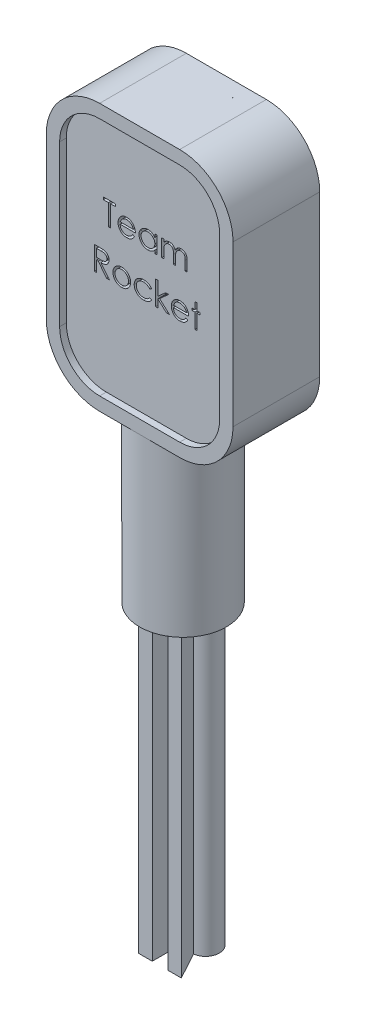
from build123d import *

# Parameters (mm, degrees)
BOSS_EXTRUDE4_DEPTH = 45
SKETCH9_R           = 6.5
BOSS_EXTRUDE5_DEPTH = 25
SKETCH10_W          = 28
SKETCH10_H          = 13
SKETCH10_R          = 0.037506011
BOSS_EXTRUDE6_DEPTH = 40
FILLET3_R           = 8
FILLET4_R           = 8
FILLET5_R           = 8
FILLET6_R           = 8
CUT_EXTRUDE1_DEPTH  = 1
CUT_EXTRUDE2_START  = -1
CUT_EXTRUDE2_DEPTH  = 1
CUT_EXTRUDE3_DEPTH  = 1.5


with BuildPart() as part:
    # Sketch7 → Boss-Extrude4 (new body)
    with BuildSketch(Plane(origin=(0, 0, 0), x_dir=(1, 0, 0), z_dir=(0, 1, 0))):
        with BuildLine():
            Line((-2.73, 4.18), (-2.73, -3.96))
            Line((-2.73, -3.96), (-0.65, -3.96))
            Line((-0.65, -3.96), (-0.65, 0.209911087))
            Line((-0.65, 0.209911087), (-0.55, 0.209911087))
            Line((-0.55, 0.209911087), (-0.544629905, 0.2))
            Line((-0.544629905, 0.2), (1.709370676, -3.96))
            Line((1.709370676, -3.96), (3.701899661, -3.96))
            Line((3.701899661, -3.96), (1.514445796, 0.077180893))
            ThreePointArc((1.514445796, 0.077180893), (3.325047346, 2.243748049), (1.27, 4.18))
            Line((1.27, 4.18), (-2.73, 4.18))
        make_face()
    extrude(amount=BOSS_EXTRUDE4_DEPTH)

    # Sketch9 → Boss-Extrude5 (add)
    with BuildSketch(Plane(origin=(0, 45, 0), x_dir=(1, 0, 0), z_dir=(0, 1, 0))):
        with Locations(Location((0, 0, 0), (0, 0, 270))):
            Circle(SKETCH9_R)
    extrude(amount=BOSS_EXTRUDE5_DEPTH)

    # Sketch10 → Boss-Extrude6 (add)
    with BuildSketch(Plane(origin=(0, 70, 0), x_dir=(1, 0, 0), z_dir=(0, 1, 0))):
        Rectangle(SKETCH10_W, SKETCH10_H)
        with Locations(Location((3.255474538, 4.236787445, 0), (0, 0, 270))):
            Circle(SKETCH10_R, mode=Mode.SUBTRACT)
    extrude(amount=BOSS_EXTRUDE6_DEPTH)

    # Fillet3
    # the kernel refuses this fillet: 8 mm, written as the material it takes off along each edge
    with BuildSketch(Plane(origin=(14, 70, -26.5), x_dir=(-1, 0, 0), z_dir=(0, 0, 1))) as fillet3_piece_1_section:
        with BuildLine():
            CenterArc((FILLET3_R, -FILLET3_R), FILLET3_R, 90, 90)
            Line((0, -FILLET3_R), (0, 0))
            Line((0, 0), (FILLET3_R, 0))
        make_face()
    fillet3_piece_1 = extrude(amount=53, mode=Mode.PRIVATE)
    fillet3_piece_1 = fillet3_piece_1 - Plane(origin=(0, 71.811761392, 0), x_dir=(0, 0, 1), z_dir=(0, -1, 0)) * Cylinder(6.5, 138, mode=Mode.PRIVATE)
    add(fillet3_piece_1, mode=Mode.SUBTRACT)

    # Fillet4
    # the kernel refuses this fillet: 8 mm, written as the material it takes off along each edge
    with BuildSketch(Plane(origin=(-14, 70, 26.5), x_dir=(1, 0, 0), z_dir=(0, 0, -1))) as fillet4_piece_1_section:
        with BuildLine():
            CenterArc((FILLET4_R, -FILLET4_R), FILLET4_R, 90, 90)
            Line((0, -FILLET4_R), (0, 0))
            Line((0, 0), (FILLET4_R, 0))
        make_face()
    fillet4_piece_1 = extrude(amount=53, mode=Mode.PRIVATE)
    fillet4_piece_1 = fillet4_piece_1 - Plane(origin=(0, 71.811761392, 0), x_dir=(0, 0, 1), z_dir=(0, -1, 0)) * Cylinder(6.5, 138, mode=Mode.PRIVATE)
    add(fillet4_piece_1, mode=Mode.SUBTRACT)

    # Fillet5
    fillet5_edges = [part.edges().sort_by_distance(p)[0] for p in [
        (14, 110, 0),
    ]]
    fillet(fillet5_edges, radius=FILLET5_R)

    # Fillet6
    fillet6_edges = [part.edges().sort_by_distance(p)[0] for p in [
        (-14, 110, 0),
    ]]
    fillet(fillet6_edges, radius=FILLET6_R)

    # Sketch11 → Cut-Extrude1 (cut)
    with BuildSketch(Plane(origin=(0, 0, -6.5), x_dir=(-1, 0, 0), z_dir=(0, 0, -1))):
        with BuildLine():
            Line((12, 78), (12, 102))
            ThreePointArc((12, 102), (10.242640687, 106.242640687), (6, 108))
            Line((6, 108), (-6, 108))
            ThreePointArc((-6, 108), (-10.242640687, 106.242640687), (-12, 102))
            Line((-12, 102), (-12, 78))
            ThreePointArc((-12, 78), (-10.242640687, 73.757359313), (-6, 72))
            Line((-6, 72), (0, 72))
            Line((0, 72), (6, 72))
            ThreePointArc((6, 72), (10.242640687, 73.757359313), (12, 78))
        make_face()
    extrude(amount=-CUT_EXTRUDE1_DEPTH, mode=Mode.SUBTRACT)

    # Sketch12 → Cut-Extrude2 (cut)
    with BuildSketch(Plane.XY.offset(6.5).offset(CUT_EXTRUDE2_START)):
        with BuildLine():
            Line((6, 108), (-6, 108))
            ThreePointArc((-6, 108), (-10.242640687, 106.242640687), (-12, 102))
            Line((-12, 102), (-12, 78))
            ThreePointArc((-12, 78), (-10.242640687, 73.757359313), (-6, 72))
            Line((-6, 72), (0, 72))
            Line((0, 72), (6, 72))
            ThreePointArc((6, 72), (10.242640687, 73.757359313), (12, 78))
            Line((12, 78), (12, 102))
            ThreePointArc((12, 102), (10.242640687, 106.242640687), (6, 108))
        make_face()
    extrude(amount=CUT_EXTRUDE2_DEPTH, mode=Mode.SUBTRACT)

    # Sketch13 → Cut-Extrude3 (cut)
    # profile 1 of 10: a face of its own
    with BuildSketch(Plane.XY.offset(5.5)):
        Polygon((-6.439102564, 96.768314643), (-6.439102564, 97.127289002), (-4.599358974, 97.127289002), (-4.599358974, 96.768314643), (-5.362179487, 96.768314643), (-5.362179487, 93.627289002), (-5.676282051, 93.627289002), (-5.676282051, 96.768314643), align=None)
    # profile 2 of 10: a face of its own
    with BuildSketch(Plane.XY.offset(5.5)):
        with BuildLine():
            Line((-2.051482372, 94.434981309), (-1.772435897, 94.288446854))
            add(Edge.make_bspline(
                [(-1.772435897, 94.288446854), (-1.794672493, 94.249003523), (-1.837936101, 94.17226242), (-1.912336849, 94.06683056), (-1.990328922, 93.971982844), (-2.07543289, 93.89025319), (-2.165102569, 93.819001805), (-2.259835223, 93.75666398), (-2.360124041, 93.70354546), (-2.465973766, 93.658792932), (-2.578273317, 93.624383438), (-2.697294833, 93.600079217), (-2.823266329, 93.585055948), (-2.909612509, 93.583310807), (-2.953826122, 93.582417207)],
                knots=[0, 0, 0, 0, 1.120438281, 2.179929193, 3.190490725, 4.156257408, 5.095198341, 6.022838206, 6.959905092, 7.901321166, 8.864066838, 9.862729781, 10.905609505, 12, 12, 12, 12], degree=3))
            add(Edge.make_bspline(
                [(-2.953826122, 93.582417207), (-3.002968099, 93.583564382), (-3.098829861, 93.585802189), (-3.238369608, 93.605094653), (-3.369749026, 93.636567012), (-3.49296073, 93.680532553), (-3.607702982, 93.737959878), (-3.714203837, 93.807919359), (-3.813023363, 93.890051614), (-3.901047572, 93.985068058), (-3.980291455, 94.086750015), (-4.050217275, 94.192705899), (-4.108674706, 94.302669124), (-4.156227316, 94.415939648), (-4.194632181, 94.531803541), (-4.221398885, 94.651315009), (-4.236828633, 94.774150593), (-4.239193078, 94.857247929), (-4.240384615, 94.899123938)],
                knots=[0, 0, 0, 0, 1.145258523, 2.234067595, 3.276747158, 4.290159414, 5.277019952, 6.260822364, 7.254936242, 8.264827045, 9.274100331, 10.257902744, 11.220704747, 12.172965371, 13.118907548, 14.062713208, 15.023725156, 16, 16, 16, 16], degree=3))
            add(Edge.make_bspline(
                [(-4.240384615, 94.899123938), (-4.239325474, 94.938418768), (-4.237226396, 95.016295933), (-4.223995608, 95.131561477), (-4.200547315, 95.24358993), (-4.168370991, 95.352474378), (-4.126819745, 95.458032512), (-4.075987526, 95.560328575), (-4.015795148, 95.659253715), (-3.969322474, 95.721656849), (-3.945913462, 95.753090284)],
                knots=[0, 0, 0, 0, 1.024358464, 2.0301432, 3.019427413, 4.004406732, 4.986367066, 5.972626655, 6.978780325, 8, 8, 8, 8], degree=3))
            add(Edge.make_bspline(
                [(-3.945913462, 95.753090284), (-3.914205779, 95.790959154), (-3.851794832, 95.865497304), (-3.746238477, 95.96343563), (-3.63193828, 96.045479405), (-3.510326654, 96.113486541), (-3.37999018, 96.165160188), (-3.242680889, 96.203667771), (-3.096835303, 96.225245782), (-2.997130082, 96.228293615), (-2.946113782, 96.229853104)],
                knots=[0, 0, 0, 0, 1.030682036, 2.02871468, 2.997146059, 3.962720338, 4.930598197, 5.918074684, 6.934738563, 8, 8, 8, 8], degree=3))
            add(Edge.make_bspline(
                [(-2.946113782, 96.229853104), (-2.893666177, 96.228499055), (-2.790775931, 96.22584272), (-2.64074381, 96.201216387), (-2.498783093, 96.162163832), (-2.364950589, 96.107010042), (-2.239232728, 96.03585049), (-2.122446679, 95.947708648), (-2.012595166, 95.845290561), (-1.948686587, 95.766527352), (-1.916165865, 95.726447656)],
                knots=[0, 0, 0, 0, 1.056321875, 2.072262726, 3.055038591, 4.01806755, 4.982017516, 5.957941055, 6.960871419, 8, 8, 8, 8], degree=3))
            add(Edge.make_bspline(
                [(-1.916165865, 95.726447656), (-1.894038927, 95.696244074), (-1.849932334, 95.636037955), (-1.794685234, 95.537866798), (-1.746727839, 95.435156204), (-1.708394878, 95.326245907), (-1.677355377, 95.212426327), (-1.654898558, 95.092883782), (-1.641728939, 94.967653871), (-1.639140242, 94.882327315), (-1.637820513, 94.838827463)],
                knots=[0, 0, 0, 0, 0.94817472, 1.890038105, 2.849395472, 3.817997239, 4.812318967, 5.836947057, 6.897266129, 8, 8, 8, 8], degree=3))
            Line((-1.637820513, 94.838827463), (-3.926282051, 94.838827463))
            add(Edge.make_bspline(
                [(-3.926282051, 94.838827463), (-3.924742445, 94.805126999), (-3.921714871, 94.738856395), (-3.907599728, 94.641885612), (-3.885350954, 94.54951227), (-3.854081891, 94.462429228), (-3.816215046, 94.3794991), (-3.769829329, 94.301337064), (-3.714489775, 94.228299133), (-3.652764076, 94.159731996), (-3.584056981, 94.098671235), (-3.511774233, 94.044019458), (-3.434880668, 93.998213862), (-3.353982585, 93.961033972), (-3.2692108, 93.931927656), (-3.180538605, 93.912059835), (-3.088140488, 93.898752728), (-3.025154754, 93.897273063), (-2.993088942, 93.896519771)],
                knots=[0, 0, 0, 0, 1.094153842, 2.151609401, 3.174256925, 4.172055639, 5.149267565, 6.128595816, 7.11444997, 8.118368179, 9.117203808, 10.09244225, 11.054858984, 12.015122123, 12.976791628, 13.957293641, 14.960065497, 16, 16, 16, 16], degree=3))
            add(Edge.make_bspline(
                [(-2.993088942, 93.896519771), (-2.961737795, 93.897127828), (-2.899531104, 93.898334329), (-2.806890246, 93.91006624), (-2.715750719, 93.929036515), (-2.626489736, 93.954926505), (-2.54091889, 93.986503357), (-2.46167334, 94.024606215), (-2.388793124, 94.066755962), (-2.320676158, 94.114965637), (-2.254605164, 94.173973824), (-2.189062678, 94.247609545), (-2.118786024, 94.334697073), (-2.074796432, 94.400242739), (-2.051482372, 94.434981309)],
                knots=[0, 0, 0, 0, 0.99110716, 1.966546729, 2.947904876, 3.932708344, 4.903319531, 5.828989031, 6.710028674, 7.56322171, 8.463672341, 9.504779593, 10.677557249, 12, 12, 12, 12], degree=3))
        make_face()
        with BuildLine():
            add(Edge.make_bspline(
                [(-1.951923077, 95.152930027), (-1.963419701, 95.194592901), (-1.985547003, 95.274780522), (-2.031783367, 95.385821412), (-2.083854908, 95.484509313), (-2.145476639, 95.570088946), (-2.215295365, 95.646092459), (-2.295940548, 95.712511044), (-2.386376441, 95.771928495), (-2.486135582, 95.822080995), (-2.591777367, 95.864770854), (-2.702383559, 95.893395969), (-2.815241347, 95.913005512), (-2.891575633, 95.91483162), (-2.929987981, 95.91575054)],
                knots=[0, 0, 0, 0, 1.154881502, 2.222775134, 3.210006277, 4.132804581, 5.035138423, 5.962687519, 6.919655026, 7.923214229, 8.944639381, 9.960483929, 10.97369054, 12, 12, 12, 12], degree=3))
            add(Edge.make_bspline(
                [(-2.929987981, 95.91575054), (-2.961337419, 95.915138869), (-3.023308668, 95.913929723), (-3.114609737, 95.902459593), (-3.202289435, 95.883499748), (-3.286994723, 95.857534792), (-3.367615591, 95.822926189), (-3.44581036, 95.782342963), (-3.519590756, 95.732801379), (-3.565732051, 95.695042524), (-3.589042468, 95.675966886)],
                knots=[0, 0, 0, 0, 1.04873581, 2.073130211, 3.073294108, 4.04793562, 5.032784715, 6.005352987, 6.992311501, 8, 8, 8, 8], degree=3))
            add(Edge.make_bspline(
                [(-3.589042468, 95.675966886), (-3.60573575, 95.660872571), (-3.639518884, 95.630325355), (-3.684659406, 95.577696148), (-3.727879878, 95.520944586), (-3.767213531, 95.457899461), (-3.803291118, 95.389278682), (-3.837051095, 95.315661047), (-3.867437507, 95.236487917), (-3.884533617, 95.181315478), (-3.893329327, 95.152930027)],
                knots=[0, 0, 0, 0, 0.879870761, 1.780643979, 2.707998968, 3.669668524, 4.684282772, 5.740141944, 6.837334558, 8, 8, 8, 8], degree=3))
            Line((-3.893329327, 95.152930027), (-1.951923077, 95.152930027))
        make_face(mode=Mode.SUBTRACT)
    # profile 3 of 10: a face of its own
    with BuildSketch(Plane.XY.offset(5.5)):
        with BuildLine():
            Line((1.592948718, 96.184981309), (1.592948718, 93.627289002))
            Line((1.592948718, 93.627289002), (1.278846154, 93.627289002))
            Line((1.278846154, 93.627289002), (1.278846154, 94.069696854))
            add(Edge.make_bspline(
                [(1.278846154, 94.069696854), (1.243427363, 94.02965726), (1.174307148, 93.951519489), (1.05886603, 93.849437317), (0.936497852, 93.765058995), (0.807796531, 93.696909079), (0.672878288, 93.645717023), (0.5320422, 93.609330864), (0.385230819, 93.585937029), (0.284978465, 93.583601007), (0.234174679, 93.582417207)],
                knots=[0, 0, 0, 0, 1.074387032, 2.096679803, 3.090159297, 4.057316773, 5.018401886, 5.985159533, 6.978961417, 8, 8, 8, 8], degree=3))
            add(Edge.make_bspline(
                [(0.234174679, 93.582417207), (0.189006726, 93.583643579), (0.099933521, 93.58606204), (-0.031095556, 93.604824343), (-0.157187806, 93.634954965), (-0.278462378, 93.676855854), (-0.394134524, 93.732436676), (-0.505194621, 93.798977924), (-0.611067313, 93.878218754), (-0.710138852, 93.968806782), (-0.801370852, 94.06720177), (-0.881432125, 94.172147316), (-0.948185204, 94.28318962), (-1.004005285, 94.398922774), (-1.04700163, 94.520237694), (-1.076975264, 94.646714862), (-1.095715711, 94.778204735), (-1.098133171, 94.867744258), (-1.099358974, 94.913146373)],
                knots=[0, 0, 0, 0, 1.033919861, 2.038935746, 3.024066025, 3.998881131, 4.97069526, 5.957263378, 6.95902576, 7.993208707, 9.027059324, 10.027763471, 11.009749337, 11.988697705, 12.965288445, 13.950418724, 14.960734635, 16, 16, 16, 16], degree=3))
            add(Edge.make_bspline(
                [(-1.099358974, 94.913146373), (-1.098106003, 94.957610077), (-1.095628946, 95.04551242), (-1.077175726, 95.174791118), (-1.046144718, 95.299309379), (-1.00259687, 95.418666322), (-0.946754915, 95.533006372), (-0.878826828, 95.642410397), (-0.798807703, 95.747179795), (-0.706555296, 95.844851022), (-0.606620526, 95.935071636), (-0.499711795, 96.013480681), (-0.388488514, 96.08119753), (-0.271225503, 96.134851007), (-0.149658399, 96.178260111), (-0.022704953, 96.208293079), (0.109106626, 96.2259904), (0.198597118, 96.228553165), (0.243990385, 96.229853104)],
                knots=[0, 0, 0, 0, 1.020392517, 2.01726096, 2.990465484, 3.961182959, 4.928053699, 5.906110375, 6.912531644, 7.948652711, 8.985773172, 9.998621852, 10.987621588, 11.969261332, 12.953316658, 13.946091881, 14.958173133, 16, 16, 16, 16], degree=3))
            add(Edge.make_bspline(
                [(0.243990385, 96.229853104), (0.296190244, 96.228415353), (0.398551704, 96.22559599), (0.548279713, 96.202133262), (0.689924191, 96.162494795), (0.824578543, 96.108577297), (0.951759229, 96.036928568), (1.070262213, 95.946548607), (1.181327697, 95.83800742), (1.245707988, 95.754636976), (1.278846154, 95.711724098)],
                knots=[0, 0, 0, 0, 1.038897134, 2.037228247, 3.008116434, 3.962042015, 4.918381754, 5.904844433, 6.921570401, 8, 8, 8, 8], degree=3))
            Line((1.278846154, 95.711724098), (1.278846154, 96.184981309))
            Line((1.278846154, 96.184981309), (1.592948718, 96.184981309))
        make_face()
        with BuildLine():
            add(Edge.make_bspline(
                [(0.248197115, 95.91575054), (0.202282778, 95.914116902), (0.111655178, 95.910892361), (-0.021388825, 95.885718866), (-0.148702239, 95.843834272), (-0.269648313, 95.786552371), (-0.382316529, 95.714523634), (-0.4830102, 95.627402251), (-0.572552902, 95.527565237), (-0.647861166, 95.415463126), (-0.709251663, 95.295285035), (-0.752418695, 95.169660597), (-0.780887942, 95.040855619), (-0.783796463, 94.953492934), (-0.78525641, 94.909640765)],
                knots=[0, 0, 0, 0, 1.031046209, 2.035121221, 3.029706178, 4.034933723, 5.034054252, 6.02443088, 7.017295772, 8.038157696, 9.050218397, 10.03989886, 11.016116709, 12, 12, 12, 12], degree=3))
            add(Edge.make_bspline(
                [(-0.78525641, 94.909640765), (-0.783391517, 94.866050657), (-0.77966904, 94.779041301), (-0.752918346, 94.650060725), (-0.708038472, 94.524406683), (-0.64679641, 94.403145689), (-0.570109785, 94.290561589), (-0.481221132, 94.188821466), (-0.379270851, 94.101331878), (-0.266343344, 94.028094304), (-0.145735373, 93.968931783), (-0.018901442, 93.927766144), (0.111774196, 93.901188363), (0.20062653, 93.898083886), (0.245392628, 93.896519771)],
                knots=[0, 0, 0, 0, 0.979072187, 1.954306742, 2.945804271, 3.96968567, 4.997920485, 5.998718438, 6.996577872, 8.005894225, 9.015743152, 10.005417472, 10.995077863, 12, 12, 12, 12], degree=3))
            add(Edge.make_bspline(
                [(0.245392628, 93.896519771), (0.290839131, 93.898179735), (0.381227717, 93.901481238), (0.514666425, 93.926762504), (0.644161388, 93.968531302), (0.767948617, 94.026430429), (0.883264748, 94.098187785), (0.986762625, 94.182194876), (1.074278594, 94.27989806), (1.148471203, 94.387274513), (1.20664662, 94.504986509), (1.249022679, 94.6303207), (1.274076585, 94.763281448), (1.277234315, 94.854145375), (1.278846154, 94.900526181)],
                knots=[0, 0, 0, 0, 1.01762866, 2.023962475, 3.030623092, 4.058876274, 5.077231937, 6.066672613, 7.034107872, 8.005628644, 8.981990164, 9.965428785, 10.961468474, 12, 12, 12, 12], degree=3))
            add(Edge.make_bspline(
                [(1.278846154, 94.900526181), (1.277886497, 94.935864012), (1.27599759, 95.005420045), (1.261567021, 95.107547563), (1.238612094, 95.205281289), (1.206265924, 95.298723978), (1.16377464, 95.387358993), (1.112526874, 95.471822753), (1.051621424, 95.551675965), (0.982038728, 95.625819036), (0.905873525, 95.693445498), (0.825278985, 95.753809739), (0.739300238, 95.803398511), (0.649383201, 95.844439783), (0.555371866, 95.877098933), (0.456501247, 95.898886627), (0.35382226, 95.913846948), (0.283776204, 95.915109328), (0.248197115, 95.91575054)],
                knots=[0, 0, 0, 0, 1.050140795, 2.067009409, 3.05949893, 4.030605086, 5.00011959, 5.97591094, 6.962425594, 7.979863591, 8.993523472, 9.986985069, 10.967611495, 11.937549037, 12.921786183, 13.919465291, 14.943216303, 16, 16, 16, 16], degree=3))
        make_face(mode=Mode.SUBTRACT)
    # profile 4 of 10: a face of its own
    with BuildSketch(Plane.XY.offset(5.5)):
        with BuildLine():
            Line((2.310897436, 96.184981309), (2.625, 96.184981309))
            Line((2.625, 96.184981309), (2.625, 95.740470091))
            add(Edge.make_bspline(
                [(2.625, 95.740470091), (2.65328395, 95.779357693), (2.70747871, 95.853870066), (2.796344362, 95.95206035), (2.885120474, 96.035388505), (2.949053856, 96.079131377), (2.979767628, 96.100145572)],
                knots=[0, 0, 0, 0, 1.134379233, 2.173579362, 3.122582517, 4, 4, 4, 4], degree=3))
            add(Edge.make_bspline(
                [(2.979767628, 96.100145572), (3.02163229, 96.120150937), (3.10463019, 96.159812151), (3.236049415, 96.20004571), (3.370524085, 96.224770811), (3.461332298, 96.228152185), (3.507011218, 96.229853104)],
                knots=[0, 0, 0, 0, 1.014936303, 2.012140481, 3.000054389, 4, 4, 4, 4], degree=3))
            add(Edge.make_bspline(
                [(3.507011218, 96.229853104), (3.537904215, 96.228807813), (3.599039794, 96.226739239), (3.689623884, 96.213279204), (3.777482495, 96.190013031), (3.862096525, 96.157605707), (3.941817204, 96.11835902), (4.014906402, 96.072309312), (4.08053061, 96.020612237), (4.138656661, 95.960933304), (4.190925687, 95.891596705), (4.239004533, 95.810732456), (4.283429746, 95.716524795), (4.308051055, 95.648158254), (4.321013622, 95.612164803)],
                knots=[0, 0, 0, 0, 1.009824226, 1.998387844, 2.986035974, 3.974953746, 4.955485308, 5.885931332, 6.793869504, 7.679848016, 8.601185859, 9.625726857, 10.749998409, 12, 12, 12, 12], degree=3))
            add(Edge.make_bspline(
                [(4.321013622, 95.612164803), (4.334724873, 95.636889222), (4.36170669, 95.685543407), (4.407012327, 95.754401669), (4.454480124, 95.818808461), (4.504514617, 95.878814886), (4.556939204, 95.934124616), (4.612000604, 95.984920518), (4.669385385, 96.031420731), (4.749177625, 96.085743891), (4.852990233, 96.143445072), (4.983878347, 96.193473516), (5.120028519, 96.224389645), (5.212446217, 96.228019917), (5.259114583, 96.229853104)],
                knots=[0, 0, 0, 0, 0.86119277, 1.694706429, 2.50939023, 3.298075842, 4.073795165, 4.829715201, 5.57930267, 6.321991688, 7.768977793, 9.186738141, 10.579381044, 12, 12, 12, 12], degree=3))
            add(Edge.make_bspline(
                [(5.259114583, 96.229853104), (5.301996046, 96.228235883), (5.385919232, 96.225070825), (5.508096498, 96.200217352), (5.622038303, 96.157539705), (5.72751538, 96.099306068), (5.822675193, 96.026126885), (5.905391502, 95.939058047), (5.975161866, 95.838715424), (6.020740505, 95.744323436), (6.051655769, 95.660988103), (6.070717004, 95.589981811), (6.087556699, 95.511830258), (6.101537944, 95.426439997), (6.111756496, 95.333509389), (6.119327212, 95.233190513), (6.124451285, 95.125405401), (6.124813358, 95.051039901), (6.125, 95.012705668)],
                knots=[0, 0, 0, 0, 1.209669288, 2.367440248, 3.500751976, 4.631527125, 5.755587489, 6.87532382, 8.007944318, 9.190864318, 9.82315674, 10.514484317, 11.263564316, 12.079023757, 12.955305781, 13.901327259, 14.918167583, 16, 16, 16, 16], degree=3))
            Line((6.125, 95.012705668), (6.125, 93.627289002))
            Line((6.125, 93.627289002), (5.810897436, 93.627289002))
            Line((5.810897436, 93.627289002), (5.810897436, 95.014107912))
            add(Edge.make_bspline(
                [(5.810897436, 95.014107912), (5.810819553, 95.046828486), (5.810669874, 95.109712453), (5.807976242, 95.199964904), (5.802900928, 95.282233261), (5.796966289, 95.356405349), (5.78872248, 95.422654138), (5.778076548, 95.480846556), (5.766798868, 95.531440368), (5.748062877, 95.587526415), (5.718114986, 95.649396626), (5.672497506, 95.716120202), (5.615027399, 95.774201002), (5.548667243, 95.824619319), (5.473118798, 95.86561296), (5.389854075, 95.894888969), (5.299390023, 95.913011848), (5.236767235, 95.914817863), (5.204427083, 95.91575054)],
                knots=[0, 0, 0, 0, 1.253487763, 2.409012846, 3.458416907, 4.410876679, 5.259312806, 6.014470957, 6.676830364, 7.243083969, 8.276244668, 9.299465089, 10.325150304, 11.392391894, 12.482080715, 13.603491619, 14.762376348, 16, 16, 16, 16], degree=3))
            add(Edge.make_bspline(
                [(5.204427083, 95.91575054), (5.164757129, 95.914334383), (5.086354218, 95.911535517), (4.971908732, 95.882961644), (4.861937715, 95.839881394), (4.759722582, 95.777448937), (4.665694791, 95.702640573), (4.584795214, 95.613690977), (4.517963028, 95.51306105), (4.472709052, 95.419914348), (4.444119751, 95.336244904), (4.425242835, 95.263147532), (4.410559444, 95.180065964), (4.396788914, 95.087558473), (4.387801186, 94.984988293), (4.379632814, 94.872829892), (4.375811951, 94.750745932), (4.375277492, 94.666119244), (4.375, 94.622180829)],
                knots=[0, 0, 0, 0, 1.090531906, 2.155305635, 3.229839962, 4.33261226, 5.44038871, 6.529323825, 7.629011124, 8.757537029, 9.370236727, 10.061839251, 10.834451254, 11.692844982, 12.636905849, 13.66920014, 14.789842145, 16, 16, 16, 16], degree=3))
            Line((4.375, 94.622180829), (4.375, 93.627289002))
            Line((4.375, 93.627289002), (4.060897436, 93.627289002))
            Line((4.060897436, 93.627289002), (4.060897436, 94.927869931))
            add(Edge.make_bspline(
                [(4.060897436, 94.927869931), (4.060818005, 94.96456325), (4.060665188, 95.035157507), (4.05798887, 95.136391182), (4.052902249, 95.228472263), (4.0470217, 95.311293726), (4.038561522, 95.384705055), (4.02895176, 95.449099813), (4.017603149, 95.504316564), (3.998813265, 95.564879949), (3.970098796, 95.631600872), (3.923910534, 95.702741893), (3.866302954, 95.765009991), (3.798732078, 95.818168739), (3.722726396, 95.86211022), (3.638742995, 95.893769972), (3.547538082, 95.912194262), (3.484660376, 95.914542759), (3.452323718, 95.91575054)],
                knots=[0, 0, 0, 0, 1.320475261, 2.540461679, 3.643808994, 4.639130445, 5.527981419, 6.302341397, 6.981980563, 7.553956391, 8.582137848, 9.585246428, 10.591171744, 11.620968678, 12.668337649, 13.738356861, 14.836885341, 16, 16, 16, 16], degree=3))
            add(Edge.make_bspline(
                [(3.452323718, 95.91575054), (3.414307506, 95.91422008), (3.338542547, 95.911169928), (3.227240577, 95.883715654), (3.119754894, 95.840711579), (3.017800195, 95.78105176), (2.924126047, 95.707152681), (2.842117779, 95.620237786), (2.773175254, 95.521388752), (2.727443439, 95.429224236), (2.697944965, 95.347650961), (2.67834963, 95.278300013), (2.661510004, 95.201299765), (2.648995983, 95.116412654), (2.636915567, 95.02419156), (2.631085258, 94.92417707), (2.625413696, 94.816454982), (2.625141281, 94.742082437), (2.625, 94.703510957)],
                knots=[0, 0, 0, 0, 1.098833095, 2.189935336, 3.297829714, 4.440610912, 5.596351641, 6.740013378, 7.886572111, 9.072425424, 9.705826452, 10.395263256, 11.156850408, 11.985370555, 12.878090359, 13.847760091, 14.883794034, 16, 16, 16, 16], degree=3))
            Line((2.625, 94.703510957), (2.625, 93.627289002))
            Line((2.625, 93.627289002), (2.310897436, 93.627289002))
            Line((2.310897436, 93.627289002), (2.310897436, 96.184981309))
        make_face()
    # profile 5 of 10: a face of its own
    with BuildSketch(Plane.XY.offset(5.5)):
        with BuildLine():
            Line((-7.78525641, 90.293955668), (-7.084835737, 90.293955668))
            add(Edge.make_bspline(
                [(-7.084835737, 90.293955668), (-7.038094609, 90.293800082), (-6.948346464, 90.29350134), (-6.819773194, 90.291835577), (-6.702946097, 90.287061221), (-6.597926258, 90.282952638), (-6.504715603, 90.275460697), (-6.423028312, 90.26830005), (-6.353240614, 90.258926389), (-6.310994763, 90.250220966), (-6.291866987, 90.246279386)],
                knots=[0, 0, 0, 0, 1.410062039, 2.707475311, 3.878576406, 4.937260626, 5.877586885, 6.699081471, 7.410979367, 8, 8, 8, 8], degree=3))
            add(Edge.make_bspline(
                [(-6.291866987, 90.246279386), (-6.266260363, 90.239952621), (-6.215593374, 90.227434057), (-6.142643308, 90.200974456), (-6.073128984, 90.170354832), (-6.007339159, 90.134391112), (-5.945603368, 90.092816332), (-5.887285057, 90.046348209), (-5.832119594, 89.995241004), (-5.782337964, 89.938206162), (-5.735398912, 89.878369652), (-5.695810286, 89.813665896), (-5.661683806, 89.746004368), (-5.634513289, 89.67469695), (-5.612635315, 89.600435178), (-5.597209076, 89.522546382), (-5.587957888, 89.441385407), (-5.587016033, 89.386027498), (-5.586538462, 89.357958072)],
                knots=[0, 0, 0, 0, 1.027469482, 2.033020251, 3.019912614, 3.986113645, 4.951240523, 5.91722682, 6.890402269, 7.87763091, 8.8651537, 9.85103654, 10.82876324, 11.815024772, 12.821070561, 13.842952187, 14.906261191, 16, 16, 16, 16], degree=3))
            add(Edge.make_bspline(
                [(-5.586538462, 89.357958072), (-5.58800746, 89.311322968), (-5.590873855, 89.2203258), (-5.617598959, 89.088264918), (-5.661375479, 88.965075604), (-5.721698768, 88.850912966), (-5.798518244, 88.74800232), (-5.890843035, 88.657611865), (-5.998724646, 88.581971952), (-6.099153962, 88.529519148), (-6.187868162, 88.495926239), (-6.260901475, 88.47228988), (-6.340568452, 88.454027915), (-6.426105787, 88.437667783), (-6.517869442, 88.425316089), (-6.615639482, 88.416269494), (-6.719485633, 88.410615446), (-6.790824703, 88.409773441), (-6.827524038, 88.409340284)],
                knots=[0, 0, 0, 0, 1.260483769, 2.459530307, 3.627416485, 4.787058657, 5.939039949, 7.08810263, 8.267026773, 9.491475466, 10.141966685, 10.831826277, 11.566392101, 12.351337768, 13.187381173, 14.07005841, 15.007169909, 16, 16, 16, 16], degree=3))
            Line((-6.827524038, 88.409340284), (-5.541666667, 86.793955668))
            Line((-5.541666667, 86.793955668), (-5.930088141, 86.793955668))
            Line((-5.930088141, 86.793955668), (-7.215945513, 88.409340284))
            Line((-7.215945513, 88.409340284), (-7.471153846, 88.409340284))
            Line((-7.471153846, 88.409340284), (-7.471153846, 86.793955668))
            Line((-7.471153846, 86.793955668), (-7.78525641, 86.793955668))
            Line((-7.78525641, 86.793955668), (-7.78525641, 90.293955668))
        make_face()
        with BuildLine():
            Line((-7.471153846, 89.934981309), (-7.471153846, 88.768314643))
            Line((-7.471153846, 88.768314643), (-6.830328526, 88.76340679))
            add(Edge.make_bspline(
                [(-6.830328526, 88.76340679), (-6.800408487, 88.763393553), (-6.74241493, 88.763367897), (-6.658514265, 88.767361673), (-6.580394153, 88.771904992), (-6.508353401, 88.778854337), (-6.442359826, 88.787810409), (-6.382446412, 88.799013393), (-6.32851536, 88.812065456), (-6.265616822, 88.832267082), (-6.195380291, 88.8642731), (-6.119048831, 88.910838598), (-6.054046493, 88.969407718), (-5.999128631, 89.036381174), (-5.954999199, 89.110017423), (-5.923887145, 89.189433792), (-5.904144703, 89.27262539), (-5.901816157, 89.329803498), (-5.900641026, 89.358659194)],
                knots=[0, 0, 0, 0, 1.146690395, 2.22261258, 3.21895312, 4.145990853, 4.996080663, 5.770904154, 6.481378293, 7.121626537, 8.300444488, 9.431385265, 10.535395872, 11.636531494, 12.74115979, 13.810798291, 14.895190096, 16, 16, 16, 16], degree=3))
            add(Edge.make_bspline(
                [(-5.900641026, 89.358659194), (-5.901843147, 89.386805768), (-5.904225312, 89.442582006), (-5.923674081, 89.524237917), (-5.956563462, 89.601304867), (-6.0008857, 89.673469352), (-6.054884855, 89.738975088), (-6.118202668, 89.795022241), (-6.189107863, 89.841271705), (-6.255379061, 89.870826086), (-6.314613274, 89.888945939), (-6.366042934, 89.901697103), (-6.424154411, 89.911941572), (-6.48922987, 89.920149633), (-6.560991501, 89.927204577), (-6.639802152, 89.931956356), (-6.725138932, 89.93477022), (-6.784285863, 89.934909309), (-6.814903846, 89.934981309)],
                knots=[0, 0, 0, 0, 1.101028733, 2.181837193, 3.264309656, 4.369019818, 5.486613113, 6.575447106, 7.666700264, 8.788928104, 9.402425223, 10.0903467, 10.862060571, 11.710948788, 12.657782767, 13.684531032, 14.801375019, 16, 16, 16, 16], degree=3))
            Line((-6.814903846, 89.934981309), (-7.471153846, 89.934981309))
        make_face(mode=Mode.SUBTRACT)
    # profile 6 of 10: a face of its own
    with BuildSketch(Plane.XY.offset(5.5)):
        with BuildLine():
            add(Edge.make_bspline(
                [(-3.678084936, 89.396519771), (-3.630093663, 89.39549788), (-3.535994505, 89.393494201), (-3.39818662, 89.372079235), (-3.266641484, 89.339331871), (-3.140855292, 89.294060309), (-3.022438996, 89.233378358), (-2.909667752, 89.160969067), (-2.802850743, 89.075186474), (-2.738827714, 89.008828405), (-2.706330128, 88.975145572)],
                knots=[0, 0, 0, 0, 1.054011418, 2.066658804, 3.057071809, 4.030435133, 4.997543892, 5.974964718, 6.972108034, 8, 8, 8, 8], degree=3))
            add(Edge.make_bspline(
                [(-2.706330128, 88.975145572), (-2.678348174, 88.942931586), (-2.622925794, 88.879127044), (-2.551860075, 88.775671431), (-2.490638515, 88.668531331), (-2.441575554, 88.556284004), (-2.40289053, 88.439909333), (-2.375424834, 88.319007322), (-2.359087899, 88.193844974), (-2.356884932, 88.108841136), (-2.355769231, 88.065790604)],
                knots=[0, 0, 0, 0, 1.025258237, 2.030674902, 3.01204498, 3.988269485, 4.97094183, 5.956517959, 6.965070386, 8, 8, 8, 8], degree=3))
            add(Edge.make_bspline(
                [(-2.355769231, 88.065790604), (-2.356750568, 88.022490547), (-2.358689736, 87.936927613), (-2.377033353, 87.810908247), (-2.405564439, 87.688713425), (-2.446396277, 87.570854731), (-2.498754386, 87.456971904), (-2.562645074, 87.347562354), (-2.638516691, 87.242410221), (-2.724520688, 87.142408383), (-2.819572564, 87.050242168), (-2.922688712, 86.969913898), (-3.031842746, 86.901092374), (-3.148486099, 86.845655958), (-3.271553586, 86.801946258), (-3.401310654, 86.771246242), (-3.537555724, 86.752684558), (-3.630582946, 86.750300985), (-3.678084936, 86.749083873)],
                knots=[0, 0, 0, 0, 0.998656419, 1.973391657, 2.932242238, 3.890759089, 4.846373663, 5.82037756, 6.809684879, 7.83454468, 8.860553229, 9.859544525, 10.845671541, 11.83227036, 12.833544569, 13.85385346, 14.904124723, 16, 16, 16, 16], degree=3))
            add(Edge.make_bspline(
                [(-3.678084936, 86.749083873), (-3.725819655, 86.75030507), (-3.819310515, 86.752696844), (-3.956036497, 86.771174127), (-4.086026116, 86.801932109), (-4.209254715, 86.845799602), (-4.326399561, 86.901094146), (-4.436186058, 86.969705836), (-4.539385974, 87.050265991), (-4.634457958, 87.142401928), (-4.720456564, 87.242411884), (-4.796329572, 87.347561923), (-4.860219898, 87.456972016), (-4.912578102, 87.570854701), (-4.953409915, 87.688713433), (-4.981941008, 87.810908245), (-5.000284622, 87.936927614), (-5.002223791, 88.022490547), (-5.003205128, 88.065790604)],
                knots=[0, 0, 0, 0, 1.099876186, 2.154163076, 3.173186993, 4.173200201, 5.163417411, 6.152872554, 7.150605724, 8.17532212, 9.198891216, 10.186952605, 11.159729845, 12.11414092, 13.071450619, 14.029093627, 15.002601286, 16, 16, 16, 16], degree=3))
            add(Edge.make_bspline(
                [(-5.003205128, 88.065790604), (-5.002081818, 88.10860715), (-4.999857856, 88.193376553), (-4.983537347, 88.318303613), (-4.956178791, 88.439001002), (-4.917447394, 88.554926478), (-4.867932203, 88.666681914), (-4.807570916, 88.774086745), (-4.735780283, 88.877074546), (-4.680578331, 88.940796626), (-4.652644231, 88.973042207)],
                knots=[0, 0, 0, 0, 1.031353054, 2.041901799, 3.029428768, 4.008703097, 4.981709435, 5.96992636, 6.972712378, 8, 8, 8, 8], degree=3))
            add(Edge.make_bspline(
                [(-4.652644231, 88.973042207), (-4.62019564, 89.007017146), (-4.556379776, 89.073834842), (-4.449031048, 89.159367366), (-4.336537227, 89.23328344), (-4.216812301, 89.292759656), (-4.091129443, 89.339598173), (-3.9589102, 89.372163689), (-3.820634685, 89.393417043), (-3.726075064, 89.395475221), (-3.678084936, 89.396519771)],
                knots=[0, 0, 0, 0, 1.027980169, 2.021703884, 2.998553061, 3.971491411, 4.943284454, 5.930300938, 6.949603206, 8, 8, 8, 8], degree=3))
        make_face()
        with BuildLine():
            add(Edge.make_bspline(
                [(-3.679487179, 89.082417207), (-3.713424791, 89.081452615), (-3.780423919, 89.079548333), (-3.879043504, 89.065064428), (-3.973983658, 89.042116924), (-4.065424502, 89.009512868), (-4.153057675, 88.967413969), (-4.236967077, 88.915705608), (-4.317399517, 88.855072652), (-4.39278158, 88.78560998), (-4.461963892, 88.709730986), (-4.522441869, 88.628882627), (-4.573866975, 88.544376281), (-4.616707134, 88.456124069), (-4.648614322, 88.363231656), (-4.671787345, 88.266751024), (-4.686257585, 88.166485608), (-4.688143964, 88.09832459), (-4.689102564, 88.063687239)],
                knots=[0, 0, 0, 0, 1.021534396, 2.016698045, 2.994645724, 3.958388632, 4.93408049, 5.916473867, 6.921342795, 7.962252576, 8.998418191, 10.008913653, 10.997312074, 11.973003931, 12.956656626, 13.948281152, 14.957379055, 16, 16, 16, 16], degree=3))
            add(Edge.make_bspline(
                [(-4.689102564, 88.063687239), (-4.68749574, 88.018935212), (-4.684306496, 87.930110806), (-4.65837126, 87.799299684), (-4.61498498, 87.673717831), (-4.5563977, 87.554101445), (-4.482991481, 87.443429167), (-4.396504415, 87.344757683), (-4.297864714, 87.259571872), (-4.188248214, 87.188891026), (-4.069893896, 87.13273127), (-3.944637575, 87.092932295), (-3.813996881, 87.067060602), (-3.72471615, 87.064489128), (-3.679487179, 87.063186438)],
                knots=[0, 0, 0, 0, 1.016792936, 2.018143844, 3.017858371, 4.030088057, 5.03801393, 6.028138512, 7.003788237, 7.991172063, 8.984598303, 9.972568034, 10.972917682, 12, 12, 12, 12], degree=3))
            add(Edge.make_bspline(
                [(-3.679487179, 87.063186438), (-3.634260811, 87.064496718), (-3.544985215, 87.067083175), (-3.414526038, 87.092801994), (-3.289612066, 87.132905655), (-3.171380678, 87.188827865), (-3.061814075, 87.25984028), (-2.962464954, 87.344276657), (-2.876716342, 87.443690508), (-2.803382738, 87.554248037), (-2.743835995, 87.673532389), (-2.700652793, 87.799322861), (-2.674655207, 87.930104903), (-2.671474378, 88.018933234), (-2.669871795, 88.063687239)],
                knots=[0, 0, 0, 0, 1.02726834, 2.027799167, 3.010890988, 4.004497153, 4.992059811, 5.971914811, 6.958719428, 7.966827853, 8.981595046, 9.981490638, 10.983022906, 12, 12, 12, 12], degree=3))
            add(Edge.make_bspline(
                [(-2.669871795, 88.063687239), (-2.670830065, 88.098324797), (-2.672715794, 88.166486222), (-2.687190758, 88.266748676), (-2.710346298, 88.363240272), (-2.742317915, 88.456092276), (-2.784971929, 88.54460478), (-2.837388722, 88.628634507), (-2.897619748, 88.710011053), (-2.967636869, 88.785364694), (-3.042940246, 88.855099731), (-3.123405285, 88.91572912), (-3.207190263, 88.967186715), (-3.294568846, 89.009872956), (-3.386021413, 89.041820296), (-3.480828543, 89.065196928), (-3.579027353, 89.079487124), (-3.645786396, 89.081434266), (-3.679487179, 89.082417207)],
                knots=[0, 0, 0, 0, 1.042956736, 2.052379634, 3.044323526, 4.02829302, 5.004299113, 5.996692471, 7.007513377, 8.048758398, 9.090003419, 10.095195979, 11.07790575, 12.047570684, 13.018257071, 13.989683339, 14.985167495, 16, 16, 16, 16], degree=3))
        make_face(mode=Mode.SUBTRACT)
    # profile 7 of 10: a face of its own
    with BuildSketch(Plane.XY.offset(5.5)):
        with BuildLine():
            Line((0.78525641, 88.797060636), (0.522335737, 88.633699258))
            add(Edge.make_bspline(
                [(0.522335737, 88.633699258), (0.493505872, 88.669527652), (0.436759177, 88.740049762), (0.33821994, 88.831059696), (0.233208526, 88.909226737), (0.119930478, 88.972930488), (-0.001455322, 89.022151939), (-0.130470173, 89.056982144), (-0.267095678, 89.078686387), (-0.360760877, 89.081153224), (-0.408754006, 89.082417207)],
                knots=[0, 0, 0, 0, 1.026593902, 2.0206758, 2.988051866, 3.946915611, 4.916868779, 5.907761954, 6.927957743, 8, 8, 8, 8], degree=3))
            add(Edge.make_bspline(
                [(-0.408754006, 89.082417207), (-0.447112963, 89.081360365), (-0.522659886, 89.079278943), (-0.633566039, 89.066268449), (-0.739208393, 89.042626441), (-0.840249101, 89.011475484), (-0.93596952, 88.969725194), (-1.026620438, 88.918915438), (-1.113005928, 88.859865398), (-1.19262267, 88.791454852), (-1.265451677, 88.717056185), (-1.328550591, 88.637302489), (-1.383487524, 88.554582598), (-1.42659348, 88.466830856), (-1.461868651, 88.376054803), (-1.485075371, 88.280540947), (-1.500540066, 88.18151294), (-1.502309395, 88.1139946), (-1.503205128, 88.07981304)],
                knots=[0, 0, 0, 0, 1.112346261, 2.190735716, 3.231507886, 4.247384806, 5.251966152, 6.253067467, 7.256802811, 8.280671706, 9.291813951, 10.270744147, 11.225547591, 12.165006084, 13.100104208, 14.043489273, 15.009504848, 16, 16, 16, 16], degree=3))
            add(Edge.make_bspline(
                [(-1.503205128, 88.07981304), (-1.501425876, 88.035043829), (-1.497891345, 87.946108633), (-1.470189886, 87.814830532), (-1.424845478, 87.687906841), (-1.362787628, 87.566238704), (-1.284310493, 87.453644549), (-1.19213793, 87.352661094), (-1.086218847, 87.265245066), (-0.967486516, 87.192772541), (-0.838728773, 87.134511174), (-0.701338668, 87.093003841), (-0.556438887, 87.067951468), (-0.45723214, 87.064795525), (-0.406650641, 87.063186438)],
                knots=[0, 0, 0, 0, 0.966302908, 1.919585723, 2.883856336, 3.870342332, 4.860282998, 5.839159637, 6.814385684, 7.815993281, 8.834850808, 9.858348828, 10.908058873, 12, 12, 12, 12], degree=3))
            add(Edge.make_bspline(
                [(-0.406650641, 87.063186438), (-0.360295457, 87.064485935), (-0.269195218, 87.067039792), (-0.136027933, 87.088568755), (-0.009248022, 87.123812389), (0.111140008, 87.172960039), (0.224916174, 87.236487555), (0.331345349, 87.314846725), (0.432545288, 87.405783326), (0.492042264, 87.476101297), (0.522335737, 87.511904386)],
                knots=[0, 0, 0, 0, 1.039848629, 2.043578496, 3.018386758, 3.987534228, 4.954977003, 5.934852016, 6.948509513, 8, 8, 8, 8], degree=3))
            Line((0.522335737, 87.511904386), (0.78525641, 87.339428425))
            add(Edge.make_bspline(
                [(0.78525641, 87.339428425), (0.769668708, 87.316537698), (0.738545041, 87.270832221), (0.686517416, 87.206388105), (0.630397584, 87.146066422), (0.570404487, 87.089948032), (0.507321477, 87.036690013), (0.438993568, 86.988838438), (0.367623956, 86.943703616), (0.292374798, 86.903090743), (0.2140241, 86.866584422), (0.132682111, 86.835193251), (0.048702298, 86.808223145), (-0.038014078, 86.786785799), (-0.127637976, 86.76967496), (-0.219937611, 86.758321258), (-0.314881192, 86.749845977), (-0.379053344, 86.74934011), (-0.411558494, 86.749083873)],
                knots=[0, 0, 0, 0, 0.954134338, 1.905101784, 2.851144739, 3.791306361, 4.734911809, 5.6936923, 6.663572882, 7.643865596, 8.638447847, 9.640600242, 10.646758161, 11.676244097, 12.717260333, 13.78922464, 14.880174919, 16, 16, 16, 16], degree=3))
            add(Edge.make_bspline(
                [(-0.411558494, 86.749083873), (-0.461169377, 86.749975153), (-0.558407069, 86.751722068), (-0.700729577, 86.770930544), (-0.836743244, 86.79988816), (-0.966401602, 86.841451894), (-1.089724836, 86.894956669), (-1.206597955, 86.960313584), (-1.316633973, 87.038065374), (-1.418744756, 87.126828143), (-1.512526202, 87.223068784), (-1.593052392, 87.326918702), (-1.662897663, 87.43455975), (-1.718985206, 87.548369276), (-1.763632132, 87.666834648), (-1.794136965, 87.790904888), (-1.813866703, 87.919557142), (-1.816150082, 88.007290024), (-1.817307692, 88.051768168)],
                knots=[0, 0, 0, 0, 1.1129367, 2.181364009, 3.217532258, 4.231199276, 5.232079859, 6.230262199, 7.231623845, 8.250719726, 9.263571943, 10.242672461, 11.195837495, 12.138959767, 13.085126421, 14.0317438, 15.002148558, 16, 16, 16, 16], degree=3))
            add(Edge.make_bspline(
                [(-1.817307692, 88.051768168), (-1.816866676, 88.081946603), (-1.815989422, 88.14197649), (-1.805927495, 88.231071557), (-1.792929022, 88.318980102), (-1.770903285, 88.404587822), (-1.745462653, 88.489193112), (-1.712987121, 88.571776213), (-1.674891726, 88.652720886), (-1.631639779, 88.731818615), (-1.582951034, 88.807768155), (-1.529069801, 88.87952182), (-1.472025464, 88.947941585), (-1.409149352, 89.010665346), (-1.343109698, 89.070201537), (-1.272038123, 89.124959661), (-1.196342271, 89.175100652), (-1.117158948, 89.221551668), (-1.034534237, 89.262911103), (-0.948967567, 89.298544341), (-0.860974538, 89.328996917), (-0.770414393, 89.353105836), (-0.67788822, 89.373323259), (-0.582666882, 89.386041105), (-0.48511466, 89.395027378), (-0.419058637, 89.396018171), (-0.385616987, 89.396519771)],
                knots=[0, 0, 0, 0, 0.990994727, 1.971252077, 2.943264845, 3.907940874, 4.872158414, 5.844625996, 6.82015047, 7.809835459, 8.804511986, 9.781214284, 10.756496977, 11.728388426, 12.696359165, 13.676225489, 14.672885716, 15.677705647, 16.690706858, 17.706033469, 18.721040654, 19.747369689, 20.783475414, 21.830280724, 22.901553713, 24, 24, 24, 24], degree=3))
            add(Edge.make_bspline(
                [(-0.385616987, 89.396519771), (-0.343736879, 89.39559788), (-0.260185999, 89.393758706), (-0.136245293, 89.378280054), (-0.014130099, 89.354943637), (0.104017005, 89.320370807), (0.216763519, 89.278507152), (0.322298969, 89.231494437), (0.418139073, 89.176899834), (0.506066662, 89.117179719), (0.58624618, 89.049818814), (0.659500672, 88.974011856), (0.727332321, 88.890153377), (0.765789033, 88.828347646), (0.78525641, 88.797060636)],
                knots=[0, 0, 0, 0, 1.095225653, 2.184976855, 3.262915854, 4.344593502, 5.400796181, 6.407717688, 7.363229445, 8.282371371, 9.184954523, 10.097238608, 11.036792983, 12, 12, 12, 12], degree=3))
        make_face()
    # profile 8 of 10: a face of its own
    with BuildSketch(Plane.XY.offset(5.5)):
        Polygon((1.413461538, 90.383699258), (1.727564103, 90.383699258), (1.727564103, 88.308378745), (2.891426282, 89.351647976), (3.342948718, 89.351647976), (1.992588141, 88.140109515), (3.477564103, 86.793955668), (3.026742788, 86.793955668), (1.727564103, 87.972541406), (1.727564103, 86.793955668), (1.413461538, 86.793955668), align=None)
    # profile 9 of 10: a face of its own
    with BuildSketch(Plane.XY.offset(5.5)):
        with BuildLine():
            Line((5.935697115, 87.601647976), (6.21474359, 87.455113521))
            add(Edge.make_bspline(
                [(6.21474359, 87.455113521), (6.192506995, 87.41567019), (6.149243386, 87.338929087), (6.074842638, 87.233497226), (5.996850566, 87.138649511), (5.911746598, 87.056919856), (5.822076919, 86.985668471), (5.727344264, 86.923330647), (5.627055446, 86.870212126), (5.521205721, 86.825459598), (5.40890617, 86.791050104), (5.289884654, 86.766745883), (5.163913158, 86.751722615), (5.077566978, 86.749977474), (5.033353365, 86.749083873)],
                knots=[0, 0, 0, 0, 1.120438281, 2.179929193, 3.190490725, 4.156257408, 5.095198341, 6.022838206, 6.959905092, 7.901321166, 8.864066838, 9.862729781, 10.905609505, 12, 12, 12, 12], degree=3))
            add(Edge.make_bspline(
                [(5.033353365, 86.749083873), (4.984211388, 86.750231049), (4.888349626, 86.752468856), (4.748809879, 86.77176132), (4.617430461, 86.803233679), (4.494218757, 86.84719922), (4.379476505, 86.904626544), (4.27297565, 86.974586026), (4.174156124, 87.056718281), (4.086131915, 87.151734724), (4.006888032, 87.253416682), (3.936962212, 87.359372566), (3.878504781, 87.46933579), (3.830952171, 87.582606315), (3.792547306, 87.698470208), (3.765780602, 87.817981676), (3.750350854, 87.94081726), (3.747986409, 88.023914596), (3.746794872, 88.065790604)],
                knots=[0, 0, 0, 0, 1.145258523, 2.234067595, 3.276747158, 4.290159414, 5.277019952, 6.260822364, 7.254936242, 8.264827045, 9.274100331, 10.257902744, 11.220704747, 12.172965371, 13.118907548, 14.062713208, 15.023725156, 16, 16, 16, 16], degree=3))
            add(Edge.make_bspline(
                [(3.746794872, 88.065790604), (3.747854013, 88.105085435), (3.749953091, 88.182962599), (3.763183879, 88.298228144), (3.786632172, 88.410256596), (3.818808496, 88.519141044), (3.860359742, 88.624699178), (3.911191961, 88.726995242), (3.971384339, 88.825920382), (4.017857013, 88.888323516), (4.041266026, 88.91975695)],
                knots=[0, 0, 0, 0, 1.024358464, 2.0301432, 3.019427413, 4.004406732, 4.986367066, 5.972626655, 6.978780325, 8, 8, 8, 8], degree=3))
            add(Edge.make_bspline(
                [(4.041266026, 88.91975695), (4.072973708, 88.95762582), (4.135384655, 89.032163971), (4.24094101, 89.130102297), (4.355241207, 89.212146072), (4.476852833, 89.280153208), (4.607189307, 89.331826855), (4.744498598, 89.370334437), (4.890344184, 89.391912448), (4.990049405, 89.394960282), (5.041065705, 89.396519771)],
                knots=[0, 0, 0, 0, 1.030682036, 2.02871468, 2.997146059, 3.962720338, 4.930598197, 5.918074684, 6.934738563, 8, 8, 8, 8], degree=3))
            add(Edge.make_bspline(
                [(5.041065705, 89.396519771), (5.09351331, 89.395165722), (5.196403556, 89.392509387), (5.346435677, 89.367883053), (5.488396394, 89.328830499), (5.622228898, 89.273676708), (5.747946759, 89.202517157), (5.864732809, 89.114375315), (5.974584321, 89.011957228), (6.0384929, 88.933194018), (6.071013622, 88.893114322)],
                knots=[0, 0, 0, 0, 1.056321875, 2.072262726, 3.055038591, 4.01806755, 4.982017516, 5.957941055, 6.960871419, 8, 8, 8, 8], degree=3))
            add(Edge.make_bspline(
                [(6.071013622, 88.893114322), (6.09314056, 88.862910741), (6.137247153, 88.802704622), (6.192494253, 88.704533465), (6.240451648, 88.601822871), (6.278784609, 88.492912574), (6.30982411, 88.379092993), (6.332280929, 88.259550449), (6.345450548, 88.134320537), (6.348039245, 88.048993982), (6.349358974, 88.00549413)],
                knots=[0, 0, 0, 0, 0.94817472, 1.890038105, 2.849395472, 3.817997239, 4.812318967, 5.836947057, 6.897266129, 8, 8, 8, 8], degree=3))
            Line((6.349358974, 88.00549413), (4.060897436, 88.00549413))
            add(Edge.make_bspline(
                [(4.060897436, 88.00549413), (4.062437042, 87.971793666), (4.065464616, 87.905523062), (4.079579759, 87.808552279), (4.101828533, 87.716178937), (4.133097596, 87.629095895), (4.170964441, 87.546165767), (4.217350158, 87.46800373), (4.272689712, 87.3949658), (4.334415411, 87.326398663), (4.403122507, 87.265337901), (4.475405254, 87.210686125), (4.552298819, 87.164880528), (4.633196902, 87.127700639), (4.717968687, 87.098594323), (4.806640883, 87.078726502), (4.899038999, 87.065419395), (4.962024733, 87.06393973), (4.994090545, 87.063186438)],
                knots=[0, 0, 0, 0, 1.094153842, 2.151609401, 3.174256925, 4.172055639, 5.149267565, 6.128595816, 7.11444997, 8.118368179, 9.117203808, 10.09244225, 11.054858984, 12.015122123, 12.976791628, 13.957293641, 14.960065497, 16, 16, 16, 16], degree=3))
            add(Edge.make_bspline(
                [(4.994090545, 87.063186438), (5.025441692, 87.063794494), (5.087648383, 87.065000995), (5.180289241, 87.076732906), (5.271428768, 87.095703182), (5.360689751, 87.121593172), (5.446260597, 87.153170024), (5.525506147, 87.191272882), (5.598386363, 87.233422628), (5.66650333, 87.281632303), (5.732574323, 87.34064049), (5.798116809, 87.414276211), (5.868393463, 87.501363739), (5.912383055, 87.566909405), (5.935697115, 87.601647976)],
                knots=[0, 0, 0, 0, 0.99110716, 1.966546729, 2.947904876, 3.932708344, 4.903319531, 5.828989031, 6.710028674, 7.56322171, 8.463672341, 9.504779593, 10.677557249, 12, 12, 12, 12], degree=3))
        make_face()
        with BuildLine():
            add(Edge.make_bspline(
                [(6.03525641, 88.319596694), (6.023759786, 88.361259568), (6.001632484, 88.441447188), (5.95539612, 88.552488079), (5.903324579, 88.65117598), (5.841702848, 88.736755613), (5.771884122, 88.812759126), (5.691238939, 88.879177711), (5.600803046, 88.938595162), (5.501043905, 88.988747661), (5.39540212, 89.03143752), (5.284795928, 89.060062636), (5.17193814, 89.079672178), (5.095603854, 89.081498287), (5.057191506, 89.082417207)],
                knots=[0, 0, 0, 0, 1.154881502, 2.222775134, 3.210006277, 4.132804581, 5.035138423, 5.962687519, 6.919655026, 7.923214229, 8.944639381, 9.960483929, 10.97369054, 12, 12, 12, 12], degree=3))
            add(Edge.make_bspline(
                [(5.057191506, 89.082417207), (5.025842068, 89.081805535), (4.963870819, 89.080596389), (4.872569751, 89.06912626), (4.784890052, 89.050166415), (4.700184764, 89.024201458), (4.619563896, 88.989592856), (4.541369128, 88.949009629), (4.467588731, 88.899468046), (4.421447436, 88.861709191), (4.398137019, 88.842633553)],
                knots=[0, 0, 0, 0, 1.04873581, 2.073130211, 3.073294108, 4.04793562, 5.032784715, 6.005352987, 6.992311501, 8, 8, 8, 8], degree=3))
            add(Edge.make_bspline(
                [(4.398137019, 88.842633553), (4.381443737, 88.827539237), (4.347660603, 88.796992021), (4.302520082, 88.744362815), (4.259299609, 88.687611253), (4.219965956, 88.624566128), (4.18388837, 88.555945349), (4.150128392, 88.482327714), (4.11974198, 88.403154583), (4.10264587, 88.347982144), (4.09385016, 88.319596694)],
                knots=[0, 0, 0, 0, 0.879870761, 1.780643979, 2.707998968, 3.669668524, 4.684282772, 5.740141944, 6.837334558, 8, 8, 8, 8], degree=3))
            Line((4.09385016, 88.319596694), (6.03525641, 88.319596694))
        make_face(mode=Mode.SUBTRACT)
    # profile 10 of 10: a face of its own
    with BuildSketch(Plane.XY.offset(5.5)):
        Polygon((7.291666667, 90.383699258), (7.605769231, 90.383699258), (7.605769231, 89.351647976), (8.054487179, 89.351647976), (8.054487179, 89.037545412), (7.605769231, 89.037545412), (7.605769231, 86.793955668), (7.291666667, 86.793955668), (7.291666667, 89.037545412), (6.842948718, 89.037545412), (6.842948718, 89.351647976), (7.291666667, 89.351647976), align=None)
    extrude(amount=-CUT_EXTRUDE3_DEPTH, mode=Mode.SUBTRACT)


solid = part.part
